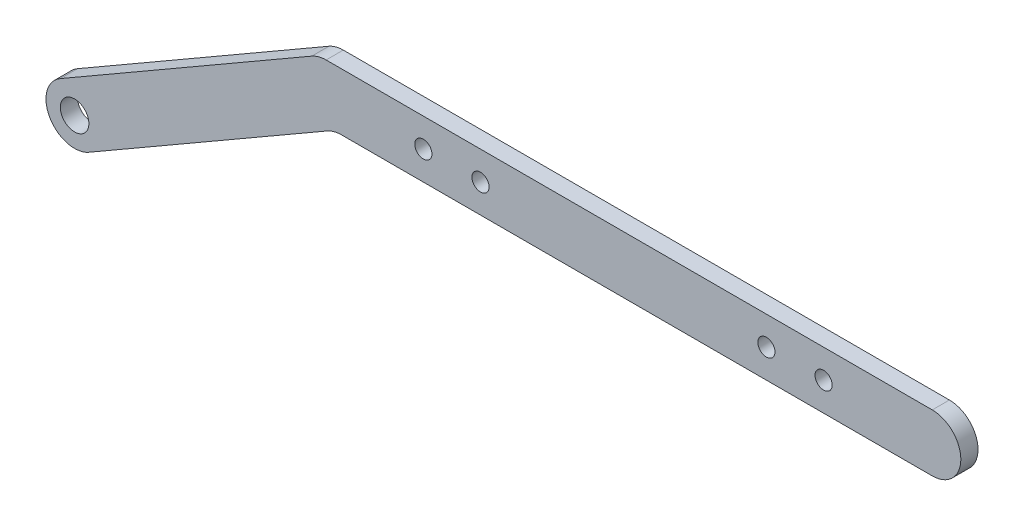
from build123d import *

# Parameters (mm, degrees)
EXTRUDE_1_DEPTH     = 3
SKETCH_2_R          = 2.5
CUT_EXTRUDE_1_DEPTH = 3
SKETCH_3_R          = 1.5
CUT_EXTRUDE_2_DEPTH = 3
SKETCH_4_R          = 1.5
CUT_EXTRUDE_3_DEPTH = 112.562384036


with BuildPart() as part:
    # 草图1 → 凸台-拉伸1 (new body)
    with BuildSketch(Plane.XY):
        with BuildLine():
            Line((-58.305836987, 5), (47.701149425, 5))
            ThreePointArc((47.701149425, 5), (52.701149425, 0), (47.701149425, -5))
            Line((47.701149425, -5), (-55.626345063, -5))
            ThreePointArc((-55.626345063, -5), (-56.920440288, -5.170370869), (-58.126345063, -5.669872981))
            Line((-58.126345063, -5.669872981), (-99.798850575, -29.729505256))
            ThreePointArc((-99.798850575, -29.729505256), (-106.628977594, -27.899378237), (-104.798850575, -21.069251218))
            Line((-104.798850575, -21.069251218), (-60.805836987, 4.330127019))
            ThreePointArc((-60.805836987, 4.330127019), (-59.599932213, 4.829629131), (-58.305836987, 5))
        make_face()
    extrude(amount=EXTRUDE_1_DEPTH)

    # 草图2 → 切除-拉伸1 (cut)
    with BuildSketch(Plane.XY.offset(3)):
        with Locations((-102.298850575, -25.399378237)):
            Circle(SKETCH_2_R)
    extrude(amount=-CUT_EXTRUDE_1_DEPTH, mode=Mode.SUBTRACT)

    # 草图3 → 切除-拉伸2 (cut)
    with BuildSketch(Plane.XY.offset(3)):
        with Locations((-31.303593391, 0)):
            Circle(SKETCH_3_R)
        with Locations((-41.303593391, 0)):
            Circle(SKETCH_3_R)
    extrude(amount=-CUT_EXTRUDE_2_DEPTH, mode=Mode.SUBTRACT)

    # 草图4 → 切除-拉伸3 (cut, through all)
    with BuildSketch(Plane(origin=(0, 0, 0), x_dir=(-1, 0, 0), z_dir=(0, 0, -1))):
        with Locations((-18.696406609, 0)):
            Circle(SKETCH_4_R)
        with Locations((-28.696406609, 0)):
            Circle(SKETCH_4_R)
    extrude(amount=-CUT_EXTRUDE_3_DEPTH, mode=Mode.SUBTRACT)


solid = part.part
